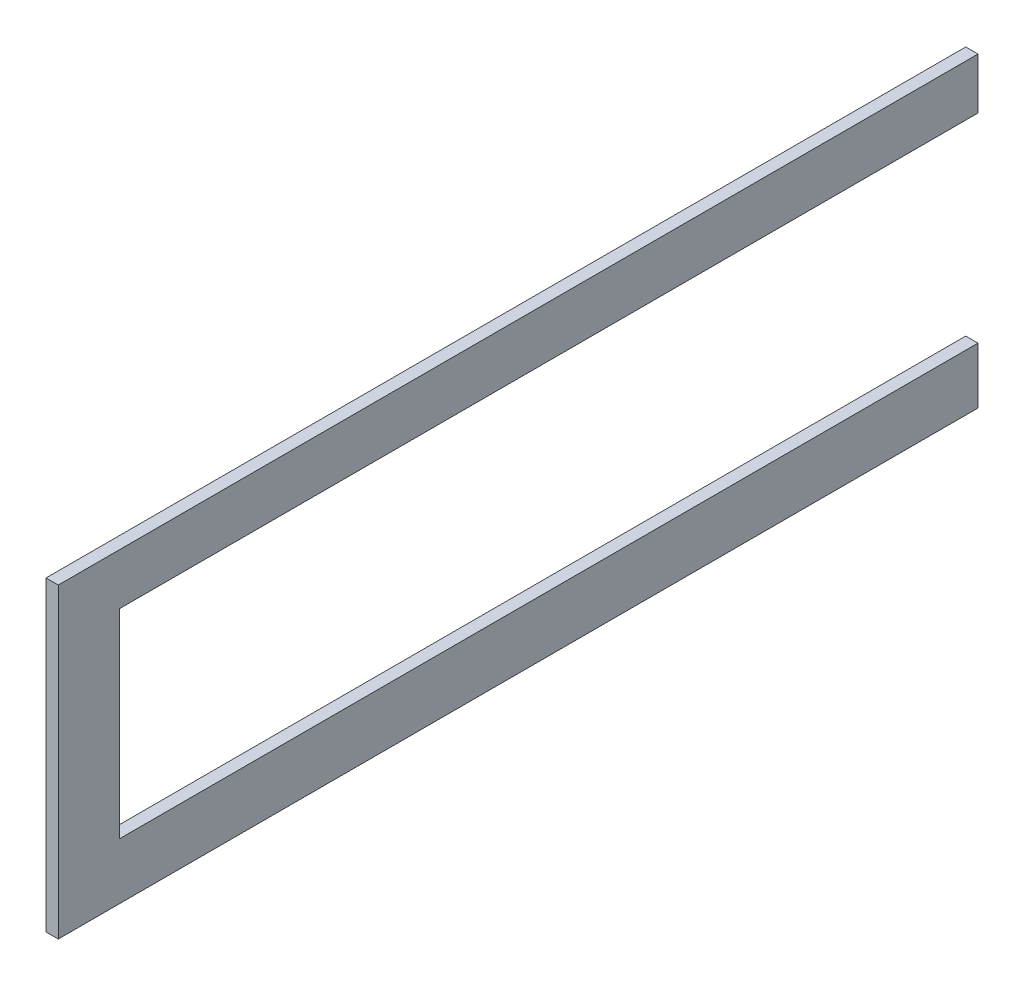
from build123d import *

# Parameters (mm, degrees)
BOSS_EXTRUDE1_DEPTH = 6


with BuildPart() as part:
    # Sketch1 → Boss-Extrude1 (new body)
    with BuildSketch(Plane(origin=(0, 0, 0), x_dir=(0, 0, -1), z_dir=(1, 0, 0))):
        Polygon((450, 125), (450, 150), (0, 150), (0, 0), (450, 0), (450, 27.5), (30, 27.5), (30, 125), align=None)
    extrude(amount=BOSS_EXTRUDE1_DEPTH)


solid = part.part
